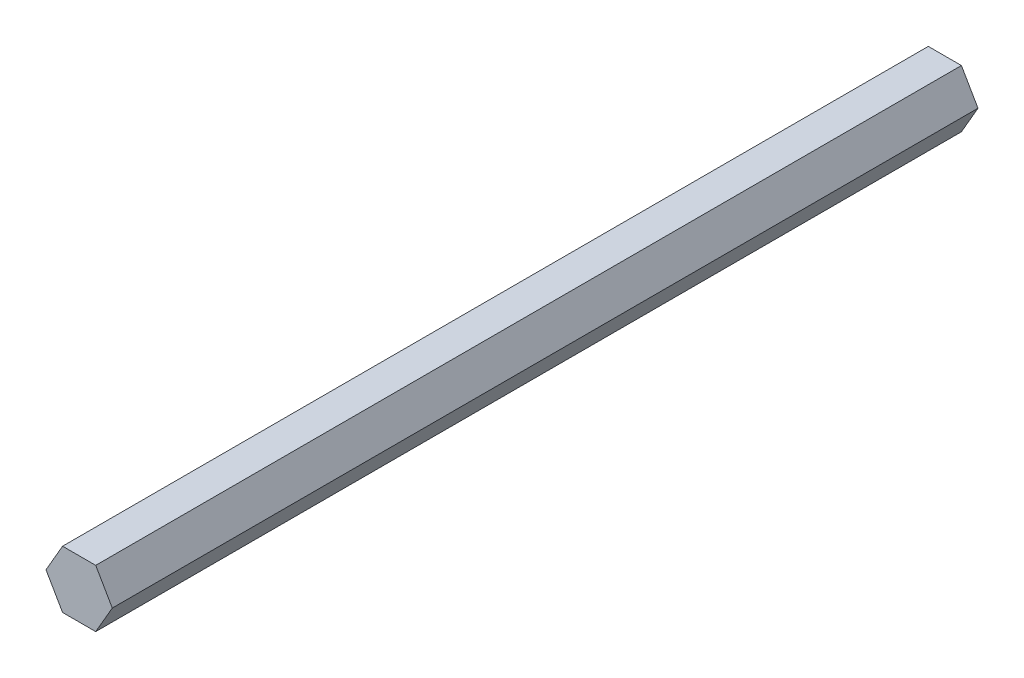
from build123d import *

# Parameters (mm, degrees)
BOSS_EXTRUDE1_DEPTH = 95.758


with BuildPart() as part:
    # Sketch1 → Boss-Extrude1 (new, symmetric)
    with BuildSketch(Plane.XY):
        Polygon((3.666174209, 6.35), (-3.666174209, 6.35), (-7.332348419, 0), (-3.666174209, -6.35), (3.666174209, -6.35), (7.332348419, 0), align=None)
    extrude(amount=BOSS_EXTRUDE1_DEPTH, both=True)


solid = part.part
